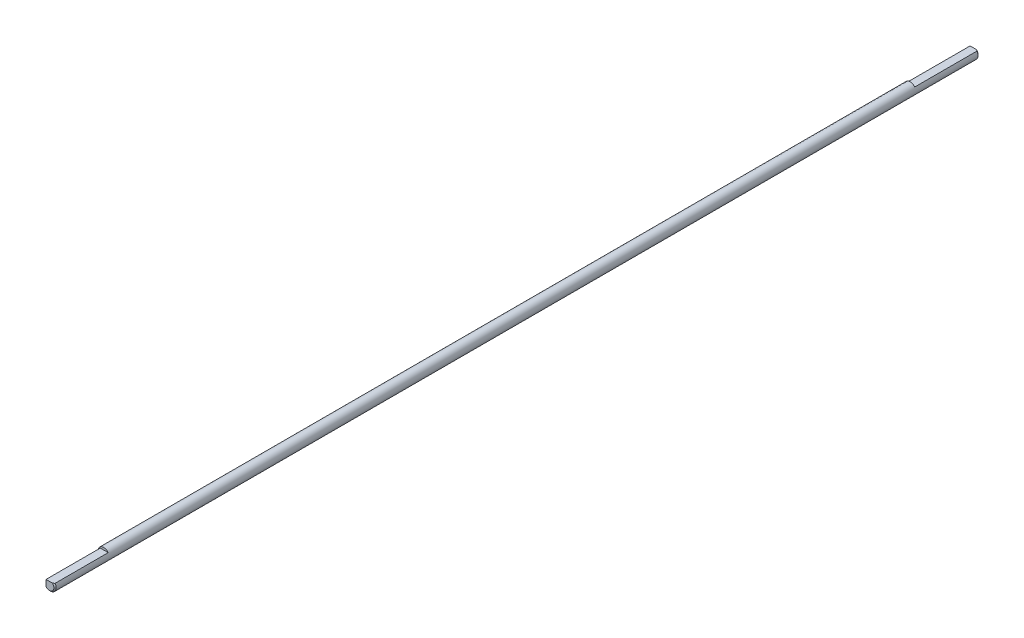
from build123d import *

# Parameters (mm, degrees)
SKETCH_1_R         = 2.5
BODY_DEPTH         = 408.5
CHAMFEREDGES_SIZE  = 0.5
SKETCH2_W          = 28.630475487
SKETCH2_H          = 2.50986962
SKETCH2_W_2        = 28
SKETCH2_H_2        = 1.942146438
FIRSTSLOTS_DEPTH   = 409.515299591
ANOTHERSLOTS_COUNT = 2
ANOTHERSLOTS_ANGLE = 90


with BuildPart() as part:
    # Эскиз1 → Body (new body)
    with BuildSketch(Plane.XY):
        Circle(SKETCH_1_R)
    extrude(amount=BODY_DEPTH)

    # ChamferEdges
    chamferedges_edges = [part.edges().sort_by_distance(p)[0] for p in [
        (-2.5, 0, 408.5),
        (-2.5, 0, 0),
    ]]
    chamfer(chamferedges_edges, length=CHAMFEREDGES_SIZE)

    # Sketch2 → FirstSlots (cut, symmetric)
    with BuildSketch(Plane(origin=(0, 0, 0), x_dir=(0, 0, -1), z_dir=(1, 0, 0))):
        with Locations((-13.684762257, 2.75493481)):
            Rectangle(SKETCH2_W, SKETCH2_H)
        with Locations((-398.5, 2.471073219)):
            Rectangle(SKETCH2_W_2, SKETCH2_H_2)
    firstslots = extrude(amount=FIRSTSLOTS_DEPTH, both=True, mode=Mode.SUBTRACT)

    # AnotherSlots: FirstSlots ×2 about axis
    anotherslots_axis = Axis((0, 0, 408.5), (0, 0, 1))
    for i in range(1, ANOTHERSLOTS_COUNT):
        add(firstslots.rotate(anotherslots_axis, i * ANOTHERSLOTS_ANGLE / (ANOTHERSLOTS_COUNT - 1)), mode=Mode.SUBTRACT)


solid = part.part
